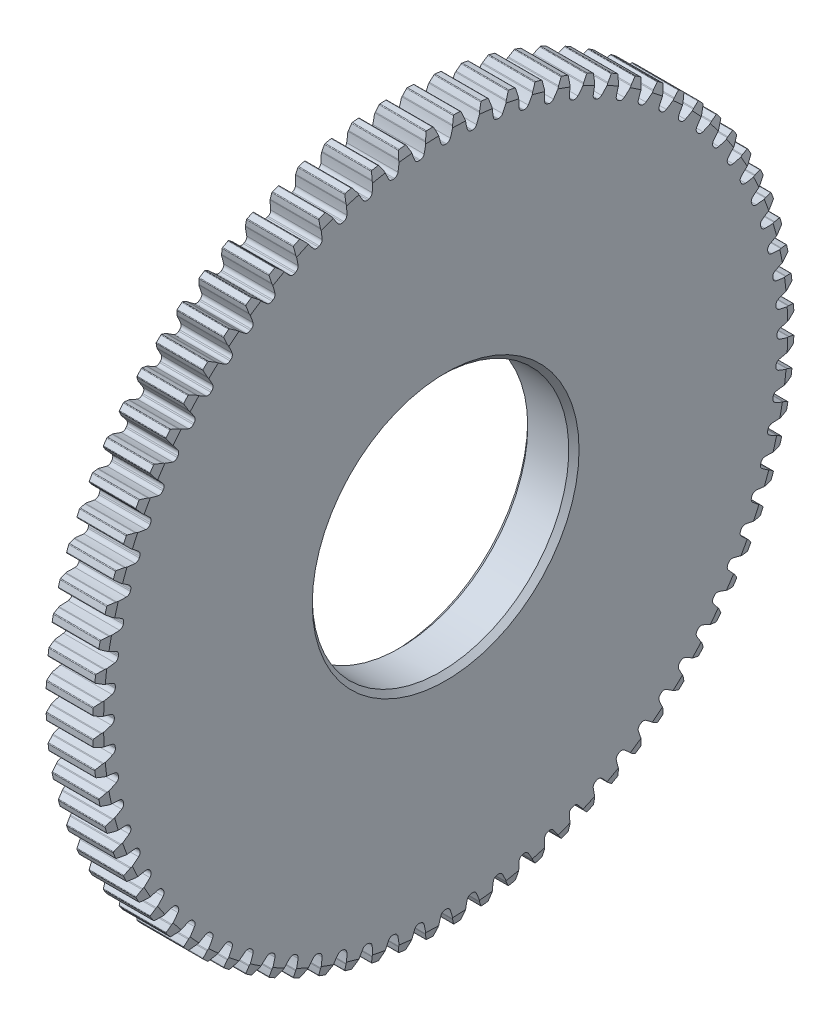
from build123d import *

# Parameters (mm, degrees)
CUT_EXTRUDE1_DEPTH = 30.146183284
CIRPATTERN1_COUNT  = 80
SKETCH4_R          = 7.5
CUT_EXTRUDE2_DEPTH = 30.132576107
CHAMFER3_SIZE      = 0.3


with BuildPart() as part:
    # Sketch1 → Revolve1 (revolve)
    with BuildSketch(Plane.XY, mode=Mode.PRIVATE) as revolve1_sk:
        Polygon((0, 0), (0, 20), (0.133974596, 20.5), (2.866025404, 20.5), (3, 20), (3, 0), align=None)
    revolve(revolve1_sk.sketch.rotate(Axis((0, 0, 0), (1, 0, 0)), 90), axis=Axis((0, 0, 0), (1, 0, 0)))

    # Sketch2 → Cut-Extrude1 (cut, through all)
    with BuildSketch(Plane(origin=(0, 0, 0), x_dir=(0, 0, -1), z_dir=(1, 0, 0))):
        with BuildLine():
            ThreePointArc((0.035816704, 19.374966895), (0, 19.375), (-0.035816704, 19.374966895))
            ThreePointArc((-0.035816704, 19.374966895), (-0.181862174, 19.421728928), (-0.273131123, 19.544960198))
            ThreePointArc((-0.273131123, 19.544960198), (-0.355032603, 19.806491613), (-0.425208701, 20.071410184))
            ThreePointArc((-0.425208701, 20.071410184), (-0.431720175, 20.094966666), (-0.439771306, 20.118042333))
            ThreePointArc((-0.439771306, 20.118042333), (-0.509174568, 20.290481409), (-0.583358378, 20.460918523))
            ThreePointArc((-0.583358378, 20.460918523), (-0.602455877, 20.482748236), (-0.630458998, 20.490303108))
            ThreePointArc((-0.630458998, 20.490303108), (0, 20.5), (0.630458998, 20.490303108))
            ThreePointArc((0.630458998, 20.490303108), (0.602455877, 20.482748236), (0.583358378, 20.460918523))
            ThreePointArc((0.583358378, 20.460918523), (0.509174568, 20.290481409), (0.439771306, 20.118042333))
            ThreePointArc((0.439771306, 20.118042333), (0.431720175, 20.094966666), (0.425208701, 20.071410184))
            ThreePointArc((0.425208701, 20.071410184), (0.355032603, 19.806491613), (0.273131123, 19.544960198))
            ThreePointArc((0.273131123, 19.544960198), (0.181862174, 19.421728928), (0.035816704, 19.374966895))
        make_face()
    cut_extrude1 = extrude(amount=CUT_EXTRUDE1_DEPTH, mode=Mode.SUBTRACT)

    # CirPattern1: Cut-Extrude1 ×80 about axis
    cirpattern1_axis = Axis((0, 0, 0), (1, 0, 0))
    for i in range(1, CIRPATTERN1_COUNT):
        add(cut_extrude1.rotate(cirpattern1_axis, i * 360 / CIRPATTERN1_COUNT), mode=Mode.SUBTRACT)

    # Sketch4 → Cut-Extrude2 (cut, through all)
    with BuildSketch(Plane.ZY):
        Circle(SKETCH4_R)
    extrude(amount=-CUT_EXTRUDE2_DEPTH, mode=Mode.SUBTRACT)

    # Chamfer3
    chamfer3_edges = [part.edges().sort_by_distance(p)[0] for p in [
        (3, 0, -7.5),
        (0, 0, -7.5),
    ]]
    chamfer(chamfer3_edges, length=CHAMFER3_SIZE)


solid = part.part
